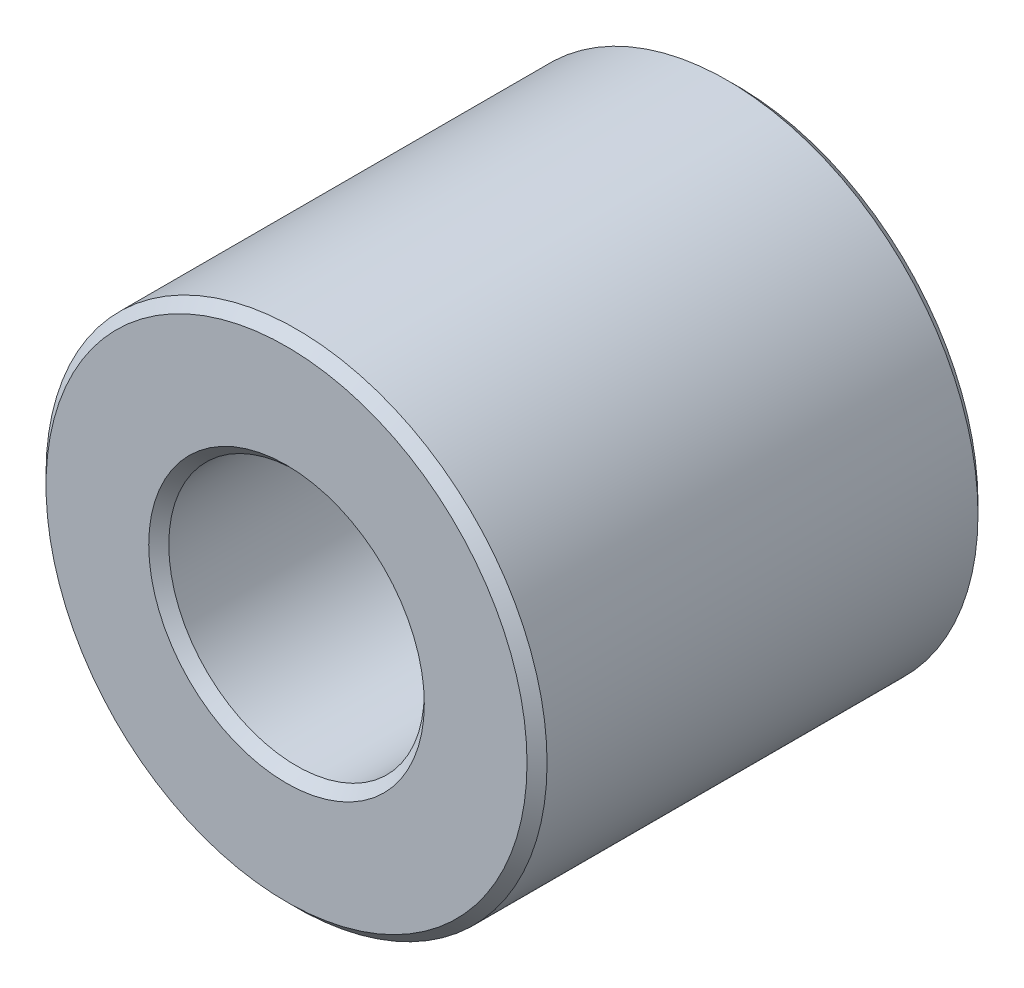
from build123d import *

# Parameters (mm, degrees)
SKETCH1_R           = 5
SKETCH1_R_2         = 2.55
BOSS_EXTRUDE1_DEPTH = 9
CHAMFER1_SIZE       = 0.2


with BuildPart() as part:
    # Sketch1 → Boss-Extrude1 (new body)
    with BuildSketch(Plane.XY):
        Circle(SKETCH1_R)
        Circle(SKETCH1_R_2, mode=Mode.SUBTRACT)
    extrude(amount=BOSS_EXTRUDE1_DEPTH)

    # Chamfer1
    chamfer1_edges = [part.edges().sort_by_distance(p)[0] for p in [
        (-5, 0, 0),
        (-2.55, 0, 0),
        (-2.55, 0, 9),
        (-5, 0, 9),
    ]]
    chamfer(chamfer1_edges, length=CHAMFER1_SIZE)


solid = part.part
